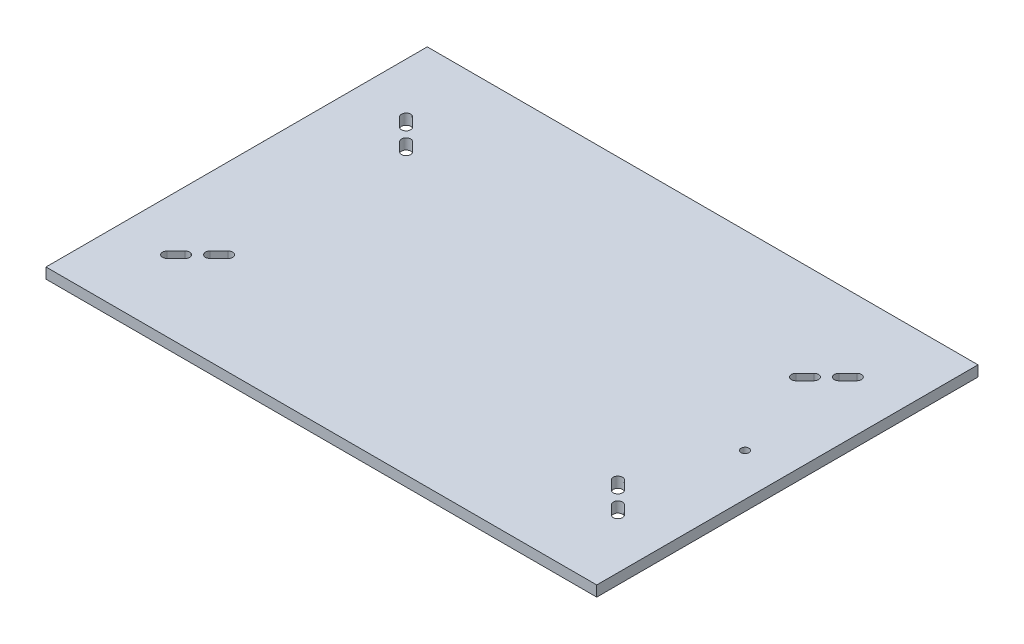
from build123d import *

# Parameters (mm, degrees)
SKETCH1_W            = 330.2
SKETCH1_H            = 228.6
BASE_PLATE_DEPTH     = 6.35
SLOTS_DEPTH          = 402.659460862
ESD_CONNECTOR_HOLE_D = 4.7625


with BuildPart() as part:
    # Sketch1 → base plate (new body)
    with BuildSketch(Plane(origin=(0, 0, 0), x_dir=(1, 0, 0), z_dir=(0, 1, 0))):
        with Locations((165.1, -114.3)):
            Rectangle(SKETCH1_W, SKETCH1_H)
    extrude(amount=-BASE_PLATE_DEPTH)

    # Sketch3 → slots (cut, through all)
    with BuildSketch(Plane(origin=(0, 0, 0), x_dir=(1, 0, 0), z_dir=(0, 1, 0))):
        with BuildLine():
            Line((33.404828058, -178.606084521), (28.016674385, -183.994238194))
            ThreePointArc((28.016674385, -183.994238194), (28.016674385, -187.883325615), (31.905761806, -187.883325615))
            Line((31.905761806, -187.883325615), (37.293915479, -182.495171942))
            ThreePointArc((37.293915479, -182.495171942), (37.293915479, -178.606084521), (33.404828058, -178.606084521))
        make_face()
        with BuildLine():
            Line((44.775105348, -175.013982073), (50.163259021, -169.6258284))
            ThreePointArc((50.163259021, -169.6258284), (50.163259021, -165.736740979), (46.2741716, -165.736740979))
            Line((46.2741716, -165.736740979), (40.886017927, -171.124894652))
            ThreePointArc((40.886017927, -171.124894652), (40.886017927, -175.013982073), (44.775105348, -175.013982073))
        make_face()
        with BuildLine():
            ThreePointArc((31.905761806, -40.716674385), (28.016674385, -40.716674385), (28.016674385, -44.605761806))
            Line((28.016674385, -44.605761806), (33.404828058, -49.993915479))
            ThreePointArc((33.404828058, -49.993915479), (37.293915479, -49.993915479), (37.293915479, -46.104828058))
            Line((37.293915479, -46.104828058), (31.905761806, -40.716674385))
        make_face()
        with BuildLine():
            ThreePointArc((46.2741716, -62.863259021), (50.163259021, -62.863259021), (50.163259021, -58.9741716))
            Line((50.163259021, -58.9741716), (44.775105348, -53.586017927))
            ThreePointArc((44.775105348, -53.586017927), (40.886017927, -53.586017927), (40.886017927, -57.475105348))
            Line((40.886017927, -57.475105348), (46.2741716, -62.863259021))
        make_face()
        with BuildLine():
            Line((296.795171942, -49.993915479), (302.183325615, -44.605761806))
            ThreePointArc((302.183325615, -44.605761806), (302.183325615, -40.716674385), (298.294238194, -40.716674385))
            Line((298.294238194, -40.716674385), (292.906084521, -46.104828058))
            ThreePointArc((292.906084521, -46.104828058), (292.906084521, -49.993915479), (296.795171942, -49.993915479))
        make_face()
        with BuildLine():
            Line((285.424894652, -53.586017927), (280.036740979, -58.9741716))
            ThreePointArc((280.036740979, -58.9741716), (280.036740979, -62.863259021), (283.9258284, -62.863259021))
            Line((283.9258284, -62.863259021), (289.313982073, -57.475105348))
            ThreePointArc((289.313982073, -57.475105348), (289.313982073, -53.586017927), (285.424894652, -53.586017927))
        make_face()
        with BuildLine():
            ThreePointArc((283.9258284, -165.736740979), (280.036740979, -165.736740979), (280.036740979, -169.6258284))
            Line((280.036740979, -169.6258284), (285.424894652, -175.013982073))
            ThreePointArc((285.424894652, -175.013982073), (289.313982073, -175.013982073), (289.313982073, -171.124894652))
            Line((289.313982073, -171.124894652), (283.9258284, -165.736740979))
        make_face()
        with BuildLine():
            ThreePointArc((298.294238194, -187.883325615), (302.183325615, -187.883325615), (302.183325615, -183.994238194))
            Line((302.183325615, -183.994238194), (296.795171942, -178.606084521))
            ThreePointArc((296.795171942, -178.606084521), (292.906084521, -178.606084521), (292.906084521, -182.495171942))
            Line((292.906084521, -182.495171942), (298.294238194, -187.883325615))
        make_face()
    extrude(amount=-SLOTS_DEPTH, mode=Mode.SUBTRACT)

    # ESD connector hole (through all)
    with Locations(Plane(origin=(0, 0, 0), x_dir=(1, 0, 0), z_dir=(0, 1, 0))):
        with Locations((304.8, -114.3)):
            Hole(ESD_CONNECTOR_HOLE_D / 2)


solid = part.part
